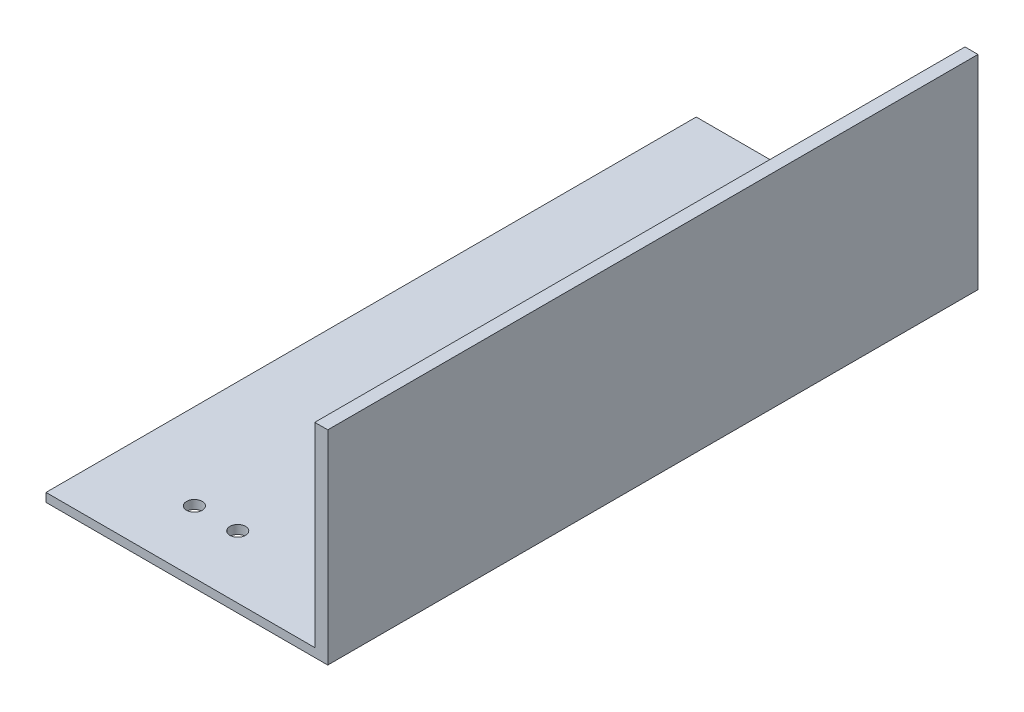
from build123d import *

# Parameters (mm, degrees)
CROQUIS1_W              = 65
CROQUIS1_H              = 150
CROQUIS1_R              = 1.8
SALIENTE_EXTRUIR1_DEPTH = 2
CROQUIS2_W              = 3
CROQUIS2_H              = 150
SALIENTE_EXTRUIR2_DEPTH = 45


with BuildPart() as part:
    # Croquis1 → Saliente-Extruir1 (new body)
    with BuildSketch(Plane(origin=(0, 0, 0), x_dir=(1, 0, 0), z_dir=(0, 1, 0))):
        Rectangle(CROQUIS1_W, CROQUIS1_H)
        with Locations((-2.7, 12.25)):
            Circle(CROQUIS1_R, mode=Mode.SUBTRACT)
        with Locations((-2.7, 60.57)):
            Circle(CROQUIS1_R, mode=Mode.SUBTRACT)
        with Locations((-12.7, -60.57)):
            Circle(CROQUIS1_R, mode=Mode.SUBTRACT)
        with Locations((-2.7, -60.57)):
            Circle(CROQUIS1_R, mode=Mode.SUBTRACT)
        with Locations((-12.7, 12.25)):
            Circle(CROQUIS1_R, mode=Mode.SUBTRACT)
        with Locations((-12.7, 60.57)):
            Circle(CROQUIS1_R, mode=Mode.SUBTRACT)
        with Locations((-12.7, -12.25)):
            Circle(CROQUIS1_R, mode=Mode.SUBTRACT)
        with Locations((-2.7, -12.25)):
            Circle(CROQUIS1_R, mode=Mode.SUBTRACT)
    extrude(amount=SALIENTE_EXTRUIR1_DEPTH)

    # Croquis2 → Saliente-Extruir2 (add)
    with BuildSketch(Plane(origin=(0, 2, 0), x_dir=(1, 0, 0), z_dir=(0, 1, 0))):
        with Locations((31, 0)):
            Rectangle(CROQUIS2_W, CROQUIS2_H)
    extrude(amount=SALIENTE_EXTRUIR2_DEPTH)


solid = part.part
